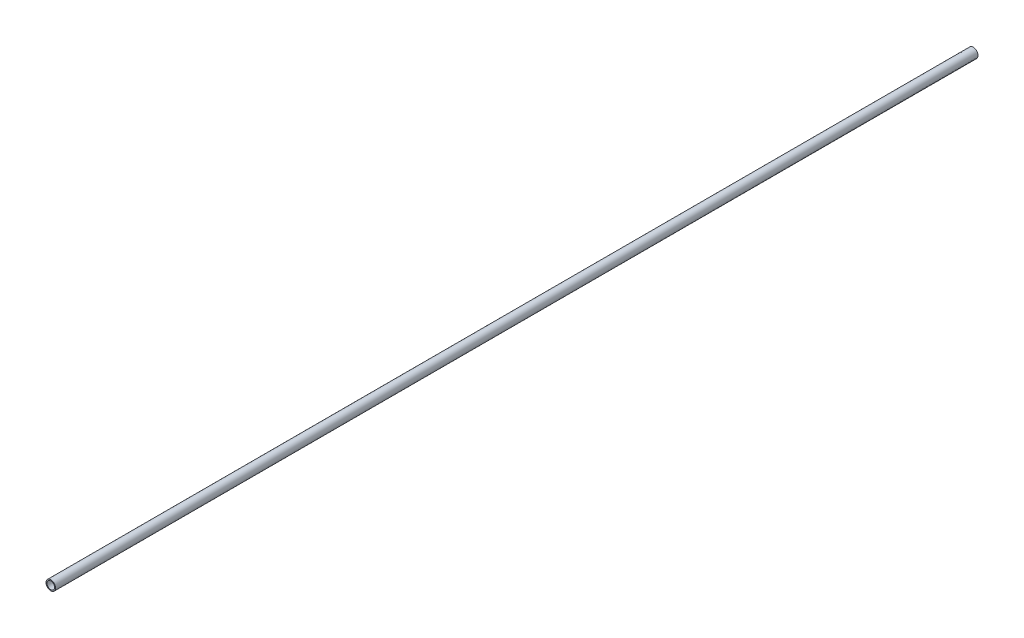
from build123d import *

# Parameters (mm, degrees)
SKETCH1_R           = 6.35
SKETCH1_R_2         = 5.08
BOSS_EXTRUDE1_DEPTH = 1219.2


with BuildPart() as part:
    # Sketch1 → Boss-Extrude1 (new body)
    with BuildSketch(Plane.XY):
        Circle(SKETCH1_R)
        Circle(SKETCH1_R_2, mode=Mode.SUBTRACT)
    extrude(amount=BOSS_EXTRUDE1_DEPTH)


solid = part.part
